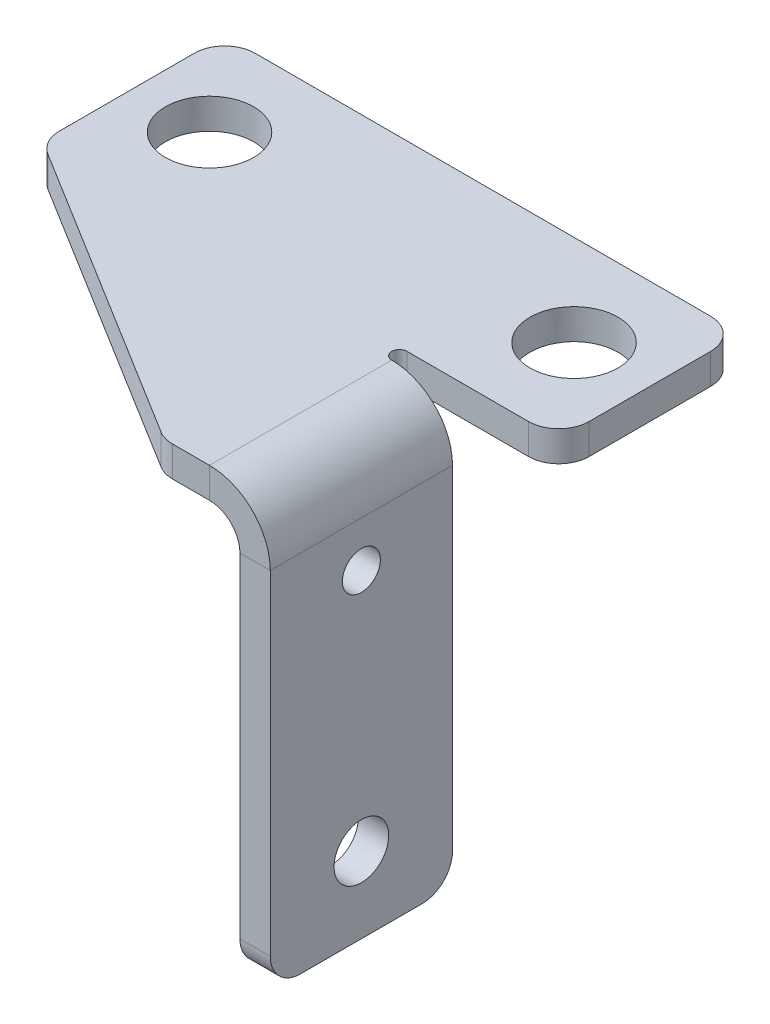
from build123d import *

# Parameters (mm, degrees)
BASE_FLANGE1_DEPTH    = 2
EDGE_FLANGE1_DEPTH    = 12
M5_CLEARANCE_HOLE1_D  = 5.8
M3_CLEARANCE_HOLE1_D  = 3.6
SKETCH14_R            = 1.25
CUT_EXTRUDE1_DEPTH    = 41.360872141
BREAK_CORNER1_START   = -8
BREAK_CORNER1_DEPTH   = 2
BREAK_CORNER1_2_DEPTH = 2


# Read off the part's stored shape, not the designer's step: Break-Corner1
# Sheet-metal steps are written as plain solids
with BuildPart() as part:
    # Sketch1 → Base-Flange1 (new body)
    with BuildSketch(Plane(origin=(0, 0, 0), x_dir=(1, 0, 0), z_dir=(0, 1, 0))):
        with BuildLine():
            Line((0, 0), (0, 12))
            Line((0, 12), (-34, 12))
            Line((-34, 12), (-34, 0))
            Line((-34, 0), (-13, -13))
            Line((-13, -13), (-10, -13))
            Line((-10, -13), (-10, -1))
            ThreePointArc((-10, -1), (-10.5, -0.5), (-10, 0))
            Line((-10, 0), (0, 0))
        make_face()
    extrude(amount=BASE_FLANGE1_DEPTH)

    # Edge-Flange1 section (across the edge) → Edge-Flange1 (add)
    with BuildSketch(Plane(origin=(-8, 0, 1), x_dir=(-1, 0, 0), z_dir=(0, 0, 1))):
        with BuildLine():
            Line((-2, 2), (-2, 26))
            Line((-2, 26), (0, 26))
            Line((0, 26), (0, 2))
            ThreePointArc((0, 2), (0.585786438, 0.585786438), (2, 0))
            Line((2, 0), (2, -2))
            ThreePointArc((2, -2), (-0.828427125, -0.828427125), (-2, 2))
        make_face()
    extrude(amount=EDGE_FLANGE1_DEPTH)

    # M5 Clearance Hole1 (through all)
    with Locations(Plane(origin=(0, 2, 0), x_dir=(1, 0, 0), z_dir=(0, 1, 0))):
        with Locations((-29, 6), (-5, 6)):
            Hole(M5_CLEARANCE_HOLE1_D / 2)

    # M3 Clearance Hole1 (through all)
    with Locations(Plane(origin=(-6, 0, 0), x_dir=(0, 0, -1), z_dir=(1, 0, 0))):
        with Locations((-7, -21)):
            Hole(M3_CLEARANCE_HOLE1_D / 2)

    # Sketch14 → Cut-Extrude1 (cut, through all)
    with BuildSketch(Plane(origin=(-6, 0, 0), x_dir=(0, 0, -1), z_dir=(1, 0, 0))):
        with Locations(Location((-7, -5, 0), (0, 0, 90))):
            Circle(SKETCH14_R)
    extrude(amount=-CUT_EXTRUDE1_DEPTH, mode=Mode.SUBTRACT)

    # Break-Corner1 outline → Break-Corner1 (cut)
    with BuildSketch(Plane.YZ.offset(BREAK_CORNER1_START)):
        with BuildLine():
            Line((-26, 1), (-24, 1))
            ThreePointArc((-24, 1), (-25.414213562, 1.585786438), (-26, 3))
            Line((-26, 3), (-26, 1))
        make_face()
        with BuildLine():
            Line((-26, 13), (-26, 11))
            ThreePointArc((-26, 11), (-25.414213562, 12.414213562), (-24, 13))
            Line((-24, 13), (-26, 13))
        make_face()
    extrude(amount=BREAK_CORNER1_DEPTH, mode=Mode.SUBTRACT)

    # Break-Corner1 2 outline → Break-Corner1 2 (cut)
    with BuildSketch(Plane(origin=(0, 0, 0), x_dir=(1, 0, 0), z_dir=(0, 1, 0))):
        with BuildLine():
            Line((-13, -13), (-12.431049528, -13))
            ThreePointArc((-12.431049528, -13), (-12.978287782, -12.923676244), (-13.483758757, -12.700530293))
            Line((-13.483758757, -12.700530293), (-13, -13))
        make_face()
        with BuildLine():
            Line((0, 0), (0, 2))
            ThreePointArc((0, 2), (-0.585786438, 0.585786438), (-2, 0))
            Line((-2, 0), (0, 0))
        make_face()
        with BuildLine():
            Line((0, 12), (-2, 12))
            ThreePointArc((-2, 12), (-0.585786438, 11.414213562), (0, 10))
            Line((0, 10), (0, 12))
        make_face()
        with BuildLine():
            Line((-34, 12), (-34, 10))
            ThreePointArc((-34, 10), (-33.414213562, 11.414213562), (-32, 12))
            Line((-32, 12), (-34, 12))
        make_face()
        with BuildLine():
            Line((-34, 0), (-33.052709229, -0.586418096))
            ThreePointArc((-33.052709229, -0.586418096), (-33.747200398, 0.14082356), (-34, 1.114112197))
            Line((-34, 1.114112197), (-34, 0))
        make_face()
    extrude(amount=BREAK_CORNER1_2_DEPTH, mode=Mode.SUBTRACT)


solid = part.part
